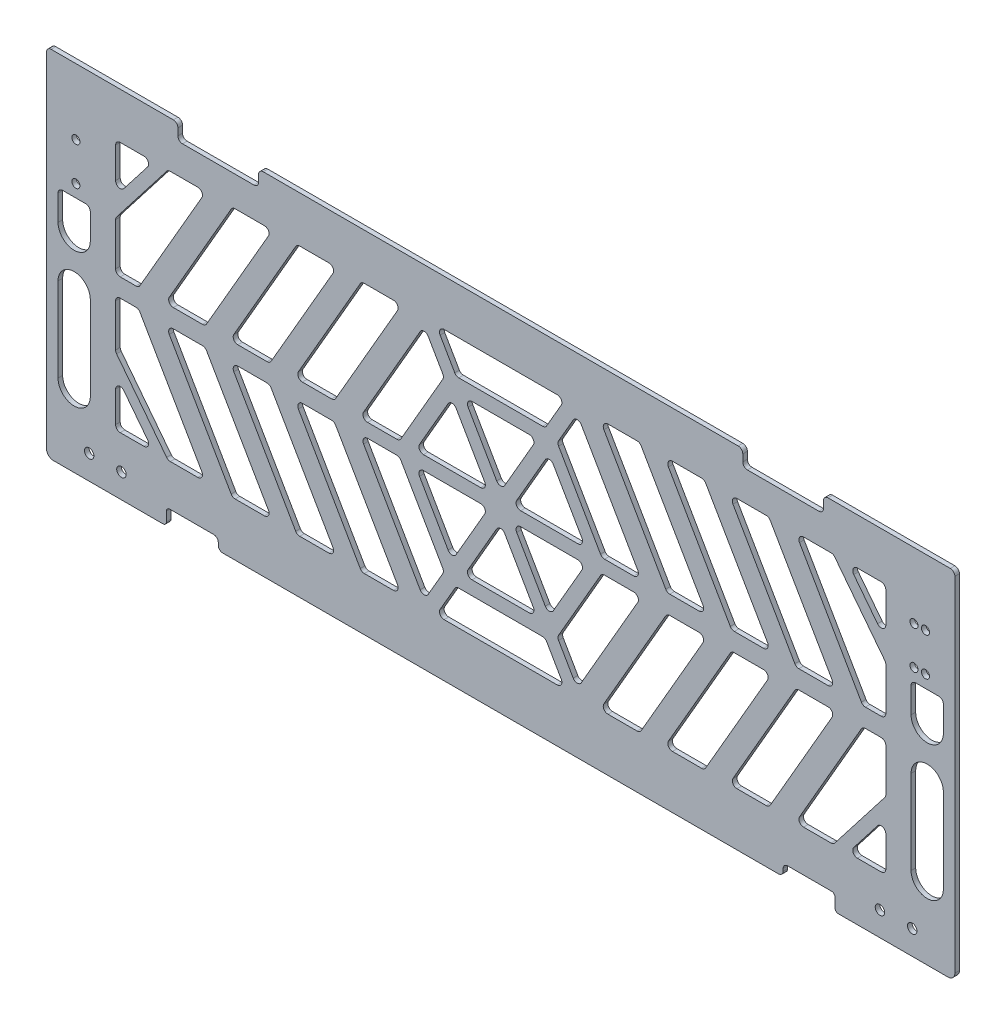
from build123d import *

# Parameters (mm, degrees)
SKETCH_1_W           = 394
SKETCH_1_H           = 159
EXTRUDE_1_DEPTH      = 2
CUT_EXTRUDE_1_DEPTH  = 10
EXTRUDE_2_DEPTH      = 2
CUT_EXTRUDE_2_DEPTH  = 10
FILLET_1_R           = 3
CUT_EXTRUDE_3_DEPTH  = 10
EXTRUDE_3_DEPTH      = 2
FILLET_2_R           = 2
CUT_EXTRUDE_4_DEPTH  = 10
SKETCH_9_W           = 290
SKETCH_9_H           = 7
CUT_EXTRUDE_5_DEPTH  = 10
SKETCH_12_R          = 2.05
CUT_EXTRUDE_8_DEPTH  = 10
FILLET_4_R           = 1.5
SKETCH_13_W          = 245
SKETCH_13_H          = 10
EXTRUDE_4_DEPTH      = 2
FILLET_5_R           = 2
EXTRUDE_5_DEPTH      = 2
SKETCH_15_R          = 1.75
CUT_EXTRUDE_9_DEPTH  = 10
FILLET_6_R           = 2
SKETCH_16_W          = 394
SKETCH_16_H          = 5
CUT_EXTRUDE_10_DEPTH = 10
FILLET_7_R           = 2
SKETCH_17_W          = 35
SKETCH_17_H          = 7
CUT_EXTRUDE_11_DEPTH = 10
FILLET_8_R           = 2
CUT_EXTRUDE_START    = -10
SKETCH_18_R          = 1.75
CUT_EXTRUDE_12_DEPTH = 10


with BuildPart() as part:
    # 草图1 → 凸台-拉伸1 (new body)
    with BuildSketch(Plane.XY):
        Rectangle(SKETCH_1_W, SKETCH_1_H)
    extrude(amount=EXTRUDE_1_DEPTH)

    # 草图2 → 切除-拉伸1 (cut)
    with BuildSketch(Plane.XY.offset(2)):
        Polygon((28.001488056, -54.5), (0, -6), (-28.001488056, -54.5), align=None)
        Polygon((33.197640478, -51.5), (61.199128534, -3), (5.196152423, -3), align=None)
        Polygon((61.199128534, 3), (33.197640478, 51.5), (5.196152423, 3), align=None)
        Polygon((0, 6), (28.001488056, 54.5), (-28.001488056, 54.5), align=None)
        Polygon((-5.196152423, 3), (-33.197640478, 51.5), (-61.199128534, 3), align=None)
        Polygon((-33.197640478, -51.5), (-5.196152423, -3), (-61.199128534, -3), align=None)
    extrude(amount=-CUT_EXTRUDE_1_DEPTH, mode=Mode.SUBTRACT)

    # 草图4 → 凸台-拉伸2 (add)
    with BuildSketch(Plane.XY.offset(2)):
        Polygon((-22.805335633, 39.5), (-45.610671266, 0), (-22.805335633, -39.5), (22.805335633, -39.5), (45.610671266, 0), (22.805335633, 39.5), align=None)
        Polygon((-19.341234018, 33.5), (-38.682468036, 0), (-19.341234018, -33.5), (19.341234018, -33.5), (38.682468036, 0), (19.341234018, 33.5), align=None, mode=Mode.SUBTRACT)
    extrude(amount=-EXTRUDE_2_DEPTH)

    # 草图5 → 切除-拉伸2 (cut)
    with BuildSketch(Plane(origin=(0, 0, 0), x_dir=(-1, 0, 0), z_dir=(0, 0, -1))):
        Polygon((60.33310313, 54.5), (43.012595055, 54.5), (72.168783649, 4), (89.489291724, 4), align=None)
        Polygon((88.33310313, 54.5), (71.012595055, 54.5), (100.168783649, 4), (117.489291724, 4), align=None)
        Polygon((116.33310313, 54.5), (99.012595055, 54.5), (128.168783649, 4), (145.489291724, 4), align=None)
        Polygon((145.489291724, -4), (128.168783649, -4), (99.012595055, -54.5), (116.33310313, -54.5), align=None)
        Polygon((117.489291724, -4), (100.168783649, -4), (71.012595055, -54.5), (88.33310313, -54.5), align=None)
        Polygon((89.489291724, -4), (72.168783649, -4), (43.012595055, -54.5), (60.33310313, -54.5), align=None)
    cut_extrude_2 = extrude(amount=-CUT_EXTRUDE_2_DEPTH, mode=Mode.SUBTRACT)

    # 镜向1: 切除-拉伸2 across plane
    add(cut_extrude_2.mirror(Plane(origin=(0, 0, 0), x_dir=(0, 0, 1), z_dir=(1, 0, 0))), mode=Mode.SUBTRACT)

    # 圆角1
    fillet_1_edges = [part.edges().sort_by_distance(p)[0] for p in [
        (197, -79.5, 1),
        (-197, -79.5, 1),
        (-197, 79.5, 1),
        (197, 79.5, 1),
    ]]
    fillet(fillet_1_edges, radius=FILLET_1_R)

    # 草图6 → 切除-拉伸3 (cut)
    with BuildSketch(Plane.XY.offset(2)):
        Polygon((127.880108514, 54.5), (157.036297108, 4), (167.036297108, 4), (167.036297108, 54.5), align=None)
        Polygon((167.036297108, -54.5), (127.880108514, -54.5), (157.036297108, -4), (167.036297108, -4), align=None)
        Polygon((-167.036297108, -4), (-167.036297108, -54.5), (-127.880108514, -54.5), (-157.036297108, -4), align=None)
        Polygon((-167.036297108, 4), (-167.036297108, 54.5), (-127.880108514, 54.5), (-157.036297108, 4), align=None)
    extrude(amount=-CUT_EXTRUDE_3_DEPTH, mode=Mode.SUBTRACT)

    # 草图7 → 凸台-拉伸3 (add)
    with BuildSketch(Plane.XY.offset(2)):
        Polygon((144.294740757, 54.5), (167.036297108, 25.170061694), (169.011980676, 30.781885909), (150.621664866, 54.5), align=None)
        Polygon((144.294740757, -54.5), (150.621664866, -54.5), (169.011980676, -30.781885909), (167.036297108, -25.170061694), align=None)
    extrude_3 = extrude(amount=-EXTRUDE_3_DEPTH)

    # 镜向2: 凸台-拉伸3 across plane
    add(extrude_3.mirror(Plane(origin=(0, 0, 0), x_dir=(0, 0, 1), z_dir=(1, 0, 0))))

    # 圆角2
    fillet_2_edges = [part.edges().sort_by_distance(p)[0] for p in [
        (-15.877132403, 33.5, 1),
        (-19.341234018, 39.5, 1),
        (-36.950417228, 3, 1),
        (-43.878620458, 3, 1),
        (36.950417228, 3, 1),
        (43.878620458, 3, 1),
        (21.073284825, -30.5, 1),
        (24.537386441, -36.5, 1),
        (-21.073284825, -30.5, 1),
        (-24.537386441, -36.5, 1),
        (-15.877132403, -33.5, 1),
        (-19.341234018, -39.5, 1),
        (19.341234018, -39.5, 1),
        (15.877132403, -33.5, 1),
        (-36.950417228, -3, 1),
        (43.878620458, -3, 1),
        (36.950417228, -3, 1),
        (24.537386441, 36.5, 1),
        (21.073284825, 30.5, 1),
        (-24.537386441, 36.5, 1),
        (-21.073284825, 30.5, 1),
        (19.341234018, 39.5, 1),
        (15.877132403, 33.5, 1),
        (-43.878620458, -3, 1),
        (-128.168783649, 4, 1),
        (-99.012595055, 54.5, 1),
        (-116.33310313, 54.5, 1),
        (-145.489291724, 4, 1),
        (-100.168783649, 4, 1),
        (-71.012595055, 54.5, 1),
        (-88.33310313, 54.5, 1),
        (-117.489291724, 4, 1),
        (-100.168783649, -4, 1),
        (-117.489291724, -4, 1),
        (-88.33310313, -54.5, 1),
        (-71.012595055, -54.5, 1),
        (-128.168783649, -4, 1),
        (-145.489291724, -4, 1),
        (-116.33310313, -54.5, 1),
        (-99.012595055, -54.5, 1),
        (-72.168783649, -4, 1),
        (-89.489291724, -4, 1),
        (-60.33310313, -54.5, 1),
        (-43.012595055, -54.5, 1),
        (-72.168783649, 4, 1),
        (-43.012595055, 54.5, 1),
        (-60.33310313, 54.5, 1),
        (-89.489291724, 4, 1),
        (-28.001488056, 54.5, 1),
        (28.001488056, 54.5, 1),
        (0, 6, 1),
        (99.012595055, 54.5, 1),
        (128.168783649, 4, 1),
        (145.489291724, 4, 1),
        (116.33310313, 54.5, 1),
        (71.012595055, 54.5, 1),
        (100.168783649, 4, 1),
        (117.489291724, 4, 1),
        (88.33310313, 54.5, 1),
        (117.489291724, -4, 1),
        (100.168783649, -4, 1),
        (71.012595055, -54.5, 1),
        (88.33310313, -54.5, 1),
        (145.489291724, -4, 1),
        (128.168783649, -4, 1),
        (99.012595055, -54.5, 1),
        (116.33310313, -54.5, 1),
        (-61.199128534, 3, 1),
        (-33.197640478, 51.5, 1),
        (-5.196152423, 3, 1),
        (89.489291724, -4, 1),
        (72.168783649, -4, 1),
        (43.012595055, -54.5, 1),
        (60.33310313, -54.5, 1),
        (43.012595055, 54.5, 1),
        (72.168783649, 4, 1),
        (89.489291724, 4, 1),
        (60.33310313, 54.5, 1),
        (5.196152423, 3, 1),
        (33.197640478, 51.5, 1),
        (61.199128534, 3, 1),
        (-157.036297108, 4, 1),
        (-167.036297108, 4, 1),
        (-167.036297108, 54.5, 1),
        (-127.880108514, 54.5, 1),
        (-167.036297108, -4, 1),
        (-157.036297108, -4, 1),
        (-127.880108514, -54.5, 1),
        (-167.036297108, -54.5, 1),
        (5.196152423, -3, 1),
        (167.036297108, -4, 1),
        (167.036297108, -54.5, 1),
        (127.880108514, -54.5, 1),
        (157.036297108, -4, 1),
        (61.199128534, -3, 1),
        (33.197640478, -51.5, 1),
        (127.880108514, 54.5, 1),
        (167.036297108, 54.5, 1),
        (167.036297108, 4, 1),
        (157.036297108, 4, 1),
        (167.036297108, 33.329938306, 1),
        (150.621664866, 54.5, 1),
        (167.036297108, 25.170061694, 1),
        (144.294740757, 54.5, 1),
        (-61.199128534, -3, 1),
        (-5.196152423, -3, 1),
        (-33.197640478, -51.5, 1),
        (150.621664866, -54.5, 1),
        (167.036297108, -33.329938306, 1),
        (167.036297108, -25.170061694, 1),
        (144.294740757, -54.5, 1),
        (-167.036297108, 33.329938306, 1),
        (-150.621664866, 54.5, 1),
        (-144.294740757, 54.5, 1),
        (-167.036297108, 25.170061694, 1),
        (-167.036297108, -33.329938306, 1),
        (-150.621664866, -54.5, 1),
        (-167.036297108, -25.170061694, 1),
        (-144.294740757, -54.5, 1),
        (0, -6, 1),
        (28.001488056, -54.5, 1),
        (-28.001488056, -54.5, 1),
    ]]
    fillet(fillet_2_edges, radius=FILLET_2_R)

    # 草图8 → 切除-拉伸4 (cut)
    with BuildSketch(Plane.XY.offset(2)):
        with BuildLine():
            Line((192, 47.5), (192, 11))
            ThreePointArc((192, 11), (185, 4), (178, 11))
            Line((178, 11), (178, 47.5))
            ThreePointArc((178, 47.5), (185, 54.5), (192, 47.5))
        make_face()
        with BuildLine():
            Line((192, -47.5), (192, -11))
            ThreePointArc((192, -11), (185, -4), (178, -11))
            Line((178, -11), (178, -47.5))
            ThreePointArc((178, -47.5), (185, -54.5), (192, -47.5))
        make_face()
    cut_extrude_4 = extrude(amount=-CUT_EXTRUDE_4_DEPTH, mode=Mode.SUBTRACT)

    # 镜向3: 切除-拉伸4 across plane
    add(cut_extrude_4.mirror(Plane(origin=(0, 0, 0), x_dir=(0, 0, 1), z_dir=(1, 0, 0))), mode=Mode.SUBTRACT)

    # 草图9 → 切除-拉伸5 (cut)
    with BuildSketch(Plane.XY.offset(2)):
        with Locations((0, -76)):
            Rectangle(SKETCH_9_W, SKETCH_9_H)
    extrude(amount=-CUT_EXTRUDE_5_DEPTH, mode=Mode.SUBTRACT)

    # 草图12 → 切除-拉伸8 (cut)
    with BuildSketch(Plane.XY.offset(2)):
        with Locations((164.5, -69)):
            Circle(SKETCH_12_R)
        with Locations((178.5, -69)):
            Circle(SKETCH_12_R)
    cut_extrude_8 = extrude(amount=-CUT_EXTRUDE_8_DEPTH, mode=Mode.SUBTRACT)

    # 镜向5: 切除-拉伸8 across plane
    add(cut_extrude_8.mirror(Plane(origin=(0, 0, 0), x_dir=(0, 0, 1), z_dir=(1, 0, 0))), mode=Mode.SUBTRACT)

    # 圆角4
    fillet_4_edges = [part.edges().sort_by_distance(p)[0] for p in [
        (-145, -79.5, 1),
        (145, -79.5, 1),
        (145, -72.5, 1),
        (-145, -72.5, 1),
    ]]
    fillet(fillet_4_edges, radius=FILLET_4_R)

    # 草图13 → 凸台-拉伸4 (add)
    with BuildSketch(Plane.XY.offset(2)):
        with Locations((0, -72.5)):
            Rectangle(SKETCH_13_W, SKETCH_13_H)
    extrude(amount=-EXTRUDE_4_DEPTH)

    # 圆角5
    fillet_5_edges = [part.edges().sort_by_distance(p)[0] for p in [
        (122.5, -72.5, 1),
        (-122.5, -72.5, 1),
        (-122.5, -77.5, 1),
        (122.5, -77.5, 1),
    ]]
    fillet(fillet_5_edges, radius=FILLET_5_R)

    # 草图14 → 凸台-拉伸5 (add)
    with BuildSketch(Plane.XY.offset(2)):
        with BuildLine():
            Line((-192, 24), (-178, 24))
            Line((-178, 24), (-178, 47.5))
            ThreePointArc((-178, 47.5), (-185, 54.5), (-192, 47.5))
            Line((-192, 47.5), (-192, 24))
        make_face()
        with BuildLine():
            Line((192, 47.5), (192, 24))
            Line((192, 24), (178, 24))
            Line((178, 24), (178, 47.5))
            ThreePointArc((178, 47.5), (185, 54.5), (192, 47.5))
        make_face()
    extrude(amount=-EXTRUDE_5_DEPTH)

    # 草图15 → 切除-拉伸9 (cut)
    with BuildSketch(Plane.XY.offset(2)):
        with Locations((-184.25, 45.924977694)):
            Circle(SKETCH_15_R)
        with Locations((-184.25, 29.424977694)):
            Circle(SKETCH_15_R)
        with Locations(Location((184.25, 29.424977694, 0), (0, 0, 180))):
            Circle(SKETCH_15_R)
        with Locations(Location((184.25, 45.924977694, 0), (0, 0, 180))):
            Circle(SKETCH_15_R)
    extrude(amount=-CUT_EXTRUDE_9_DEPTH, mode=Mode.SUBTRACT)

    # 圆角6
    fillet_6_edges = [part.edges().sort_by_distance(p)[0] for p in [
        (-178, 24, 1),
        (-192, 24, 1),
        (178, 24, 1),
        (192, 24, 1),
    ]]
    fillet(fillet_6_edges, radius=FILLET_6_R)

    # 草图16 → 切除-拉伸10 (cut)
    with BuildSketch(Plane.XY.offset(2)):
        with Locations((0, 77)):
            Rectangle(SKETCH_16_W, SKETCH_16_H)
    extrude(amount=-CUT_EXTRUDE_10_DEPTH, mode=Mode.SUBTRACT)

    # 圆角7
    fillet_7_edges = [part.edges().sort_by_distance(p)[0] for p in [
        (197, 74.5, 1),
        (-197, 74.5, 1),
    ]]
    fillet(fillet_7_edges, radius=FILLET_7_R)

    # 草图17 → 切除-拉伸11 (cut)
    with BuildSketch(Plane.XY.offset(2)):
        with Locations((122.5, 71)):
            Rectangle(SKETCH_17_W, SKETCH_17_H)
        with Locations((-122.5, 71)):
            Rectangle(SKETCH_17_W, SKETCH_17_H)
    extrude(amount=-CUT_EXTRUDE_11_DEPTH, mode=Mode.SUBTRACT)

    # 圆角8
    fillet_8_edges = [part.edges().sort_by_distance(p)[0] for p in [
        (-140, 74.5, 1),
        (-105, 74.5, 1),
        (105, 74.5, 1),
        (140, 74.5, 1),
        (140, 67.5, 1),
        (105, 67.5, 1),
        (-105, 67.5, 1),
        (-140, 67.5, 1),
    ]]
    fillet(fillet_8_edges, radius=FILLET_8_R)

    # 草图18 → 切除-拉伸12 (cut)
    with BuildSketch(Plane(origin=(0, 0, 0), x_dir=(-1, 0, 0), z_dir=(0, 0, -1)).offset(CUT_EXTRUDE_START)):
        with Locations((-179.25, 45.924977694)):
            Circle(SKETCH_18_R)
        with Locations((-179.25, 29.424977694)):
            Circle(SKETCH_18_R)
        with Locations((-184.25, 29.424977694)):
            Circle(SKETCH_18_R)
        with Locations((-184.25, 45.924977694)):
            Circle(SKETCH_18_R)
    extrude(amount=CUT_EXTRUDE_12_DEPTH, mode=Mode.SUBTRACT)


solid = part.part
